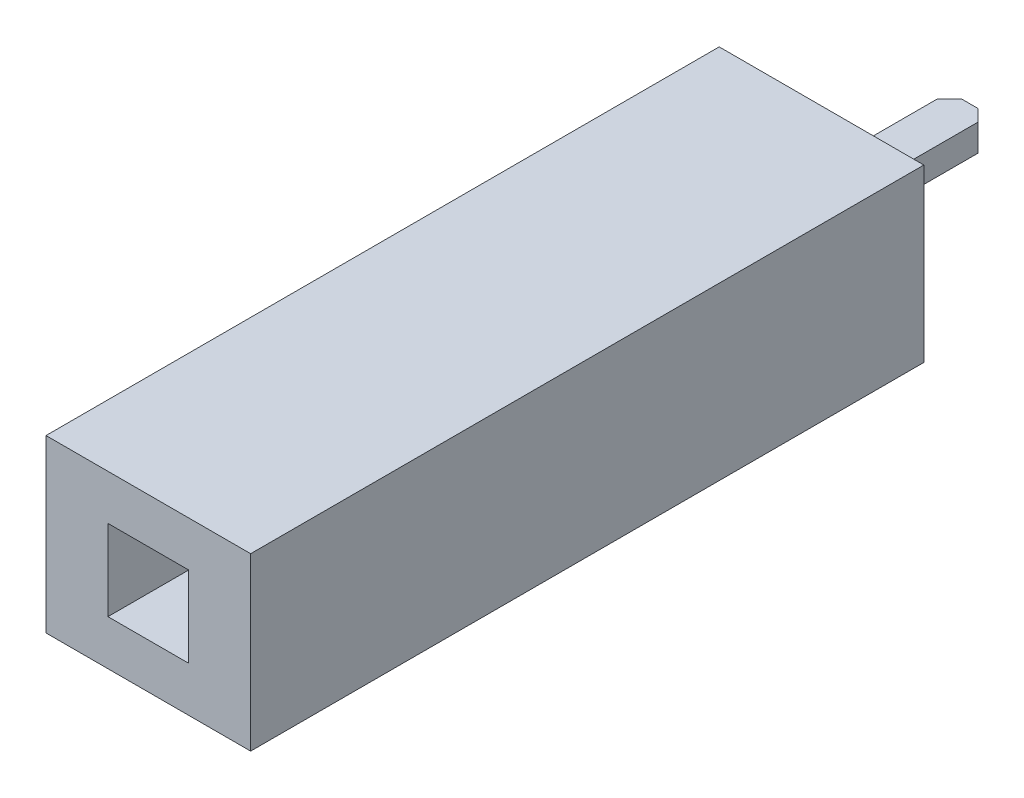
from build123d import *

# Parameters (mm, degrees)
SKETCH1_W           = 2.54
SKETCH1_H           = 10
BOSS_EXTRUDE1_DEPTH = 1.52
SKETCH2_W           = 1.2
SKETCH2_H           = 1.2
CUT_EXTRUDE1_DEPTH  = 7
BOSS_EXTRUDE2_DEPTH = 0.2


with BuildPart() as part:
    # Sketch1 → Boss-Extrude1 (new, symmetric)
    with BuildSketch(Plane(origin=(0, 0, 0), x_dir=(0, -1, 0), z_dir=(1, 0, 0))):
        with Locations((0, -5)):
            Rectangle(SKETCH1_W, SKETCH1_H)
    extrude(amount=BOSS_EXTRUDE1_DEPTH, both=True)

    # Sketch2 → Cut-Extrude1 (cut)
    with BuildSketch(Plane(origin=(0, 0, 10), x_dir=(-1, 0, 0), z_dir=(0, 0, 1))):
        Rectangle(SKETCH2_W, SKETCH2_H)
    extrude(amount=-CUT_EXTRUDE1_DEPTH, mode=Mode.SUBTRACT)

    # Sketch3 → Boss-Extrude2 (add, symmetric)
    with BuildSketch(Plane(origin=(0, 0, 0), x_dir=(1, 0, 0), z_dir=(0, 1, 0))):
        Polygon((-0.3, 0), (-0.3, 2.024264069), (-0.124264069, 2.2), (0.124264069, 2.2), (0.3, 2.024264069), (0.3, 0), align=None)
    extrude(amount=BOSS_EXTRUDE2_DEPTH, both=True)


solid = part.part
